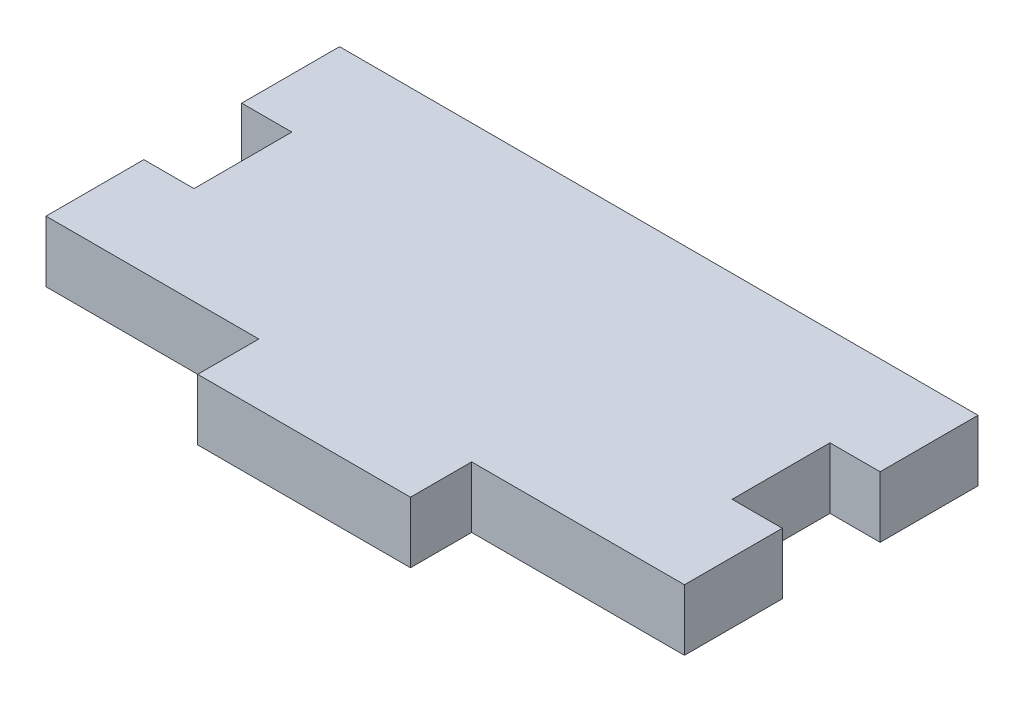
from build123d import *

# Parameters (mm, degrees)
SKETCH1_W           = 66.294
SKETCH1_H           = 30.48
BOSS_EXTRUDE1_DEPTH = 3.175
SKETCH2_W           = 22.098
SKETCH2_H           = 6.35
BOSS_EXTRUDE2_DEPTH = 6.35
CAVITY1_START       = -5.08
CAVITY1_OUTLINE_W   = 5.207
CAVITY1_OUTLINE_H   = 6.35
CAVITY1_DEPTH       = 10.16


# Read off the part's stored shape, not the designer's step: Cavity1
with BuildPart() as part:
    # Sketch1 → Boss-Extrude1 (new, symmetric)
    with BuildSketch(Plane(origin=(0, 0, 0), x_dir=(1, 0, 0), z_dir=(0, 1, 0))):
        Rectangle(SKETCH1_W, SKETCH1_H)
    extrude(amount=BOSS_EXTRUDE1_DEPTH, both=True)

    # Sketch2 → Boss-Extrude2 (add)
    with BuildSketch(Plane(origin=(0, 3.175, 0), x_dir=(1, 0, 0), z_dir=(0, 1, 0))):
        with Locations((0, -18.415)):
            Rectangle(SKETCH2_W, SKETCH2_H)
    extrude(amount=-BOSS_EXTRUDE2_DEPTH)

    # Cavity1 outline → Cavity1 (cut)
    with BuildSketch(Plane.XY.offset(CAVITY1_START)):
        with Locations((30.5435, 0)):
            Rectangle(CAVITY1_OUTLINE_W, CAVITY1_OUTLINE_H)
        with Locations((-30.5435, 0)):
            Rectangle(CAVITY1_OUTLINE_W, CAVITY1_OUTLINE_H)
    extrude(amount=CAVITY1_DEPTH, mode=Mode.SUBTRACT)


solid = part.part
